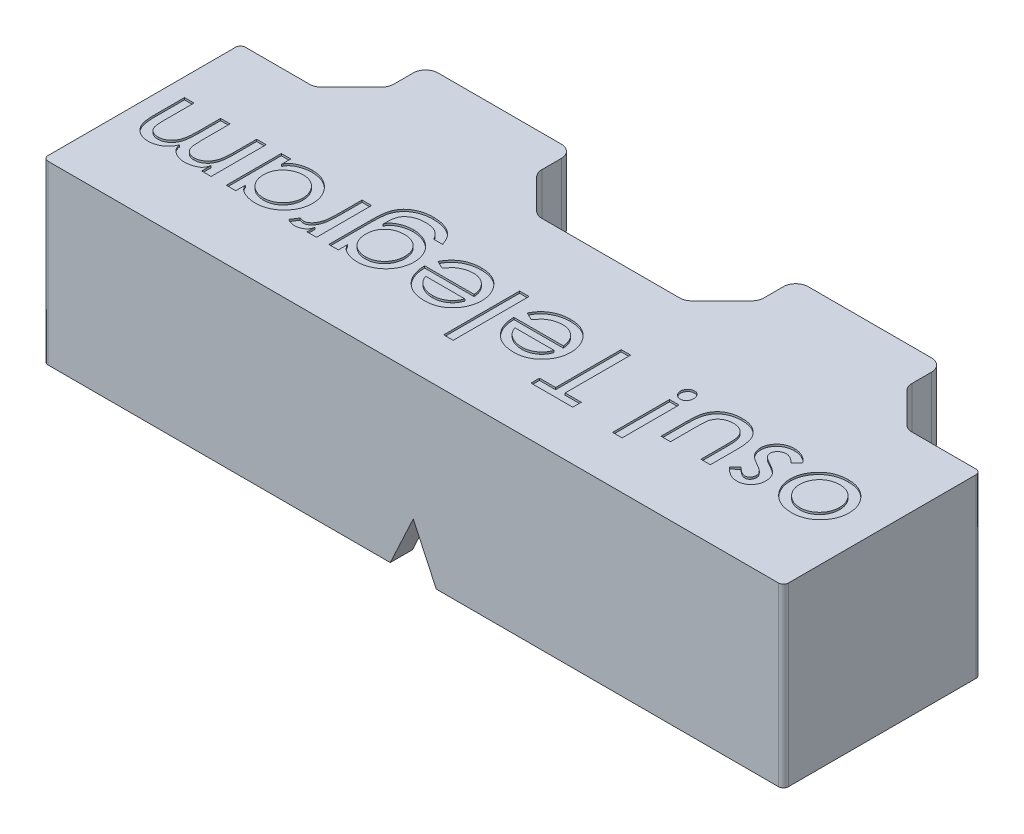
from build123d import *

# Parameters (mm, degrees)
SKETCH1_W               = 60
SKETCH1_H               = 16
BOSS_EXTRUDE1_DEPTH     = 6.5
CUT_EXTRUDE1_DEPTH      = 11
CUT_EXTRUDE1_DEPTH_BACK = 11
CUT_EXTRUDE5_DEPTH      = 11
CUT_EXTRUDE5_DEPTH_BACK = 11
BOSS_EXTRUDE2_DEPTH     = 7.8
SKETCH5_W               = 12
SKETCH5_H               = 1
CUT_EXTRUDE6_DEPTH      = 8
SKETCH6_W               = 12
SKETCH6_H               = 5.5
BOSS_EXTRUDE3_DEPTH     = 6
FILLET1_R               = 1
CHAMFER1_SIZE           = 3
FILLET2_R               = 1
FILLET3_R               = 0.4
SKETCH7_W               = 0.769230769
SKETCH7_H               = 4.615384616
SKETCH7_W_2             = 0.76923077
SKETCH7_H_2             = 6.153846154
CUT_EXTRUDE7_DEPTH      = 0.16
CUT_EXTRUDE8_REACH      = 67.487


with BuildPart() as part:
    # Sketch1 → Boss-Extrude1 (new body)
    with BuildSketch(Plane(origin=(0, 0, 0), x_dir=(1, 0, 0), z_dir=(0, 1, 0))):
        with Locations((30, -8)):
            Rectangle(SKETCH1_W, SKETCH1_H)
    extrude(amount=-BOSS_EXTRUDE1_DEPTH)

    # Sketch2 → Cut-Extrude1 (cut, two sides: drawn at the far end of the back side and taken through both)
    with BuildSketch(Plane.ZY.offset(-15).offset(-CUT_EXTRUDE1_DEPTH_BACK)):
        with BuildLine():
            Line((12.5, -6.5), (3.5, -6.5))
            ThreePointArc((3.5, -6.5), (8, -2), (12.5, -6.5))
        make_face()
    extrude(amount=CUT_EXTRUDE1_DEPTH + CUT_EXTRUDE1_DEPTH_BACK, mode=Mode.SUBTRACT)

    # Sketch3 → Cut-Extrude5 (cut, two sides: drawn at the far end of the back side and taken through both)
    with BuildSketch(Plane(origin=(45, 0, 0), x_dir=(0, 0, -1), z_dir=(1, 0, 0)).offset(-CUT_EXTRUDE5_DEPTH_BACK)):
        with BuildLine():
            Line((-12.5, -6.5), (-3.5, -6.5))
            ThreePointArc((-3.5, -6.5), (-8, -2), (-12.5, -6.5))
        make_face()
    extrude(amount=CUT_EXTRUDE5_DEPTH + CUT_EXTRUDE5_DEPTH_BACK, mode=Mode.SUBTRACT)

    # Sketch4 → Boss-Extrude2 (add)
    with BuildSketch(Plane.XZ.offset(6.5)):
        Polygon((1.8, 0), (1.8, 14.2), (58.2, 14.2), (58.2, 0), (60, 0), (60, 16), (0, 16), (0, 0), align=None)
    extrude(amount=BOSS_EXTRUDE2_DEPTH)

    # Sketch5 → Cut-Extrude6 (cut)
    with BuildSketch(Plane(origin=(0, 0, 0), x_dir=(-1, 0, 0), z_dir=(0, 0, -1))):
        with Locations((-45, -6)):
            Rectangle(SKETCH5_W, SKETCH5_H)
        with Locations((-15, -6)):
            Rectangle(SKETCH5_W, SKETCH5_H)
    extrude(amount=-CUT_EXTRUDE6_DEPTH, mode=Mode.SUBTRACT)

    # Sketch6 → Boss-Extrude3 (add)
    with BuildSketch(Plane(origin=(0, 0, 0), x_dir=(-1, 0, 0), z_dir=(0, 0, -1))):
        with Locations((-45, -2.75)):
            Rectangle(SKETCH6_W, SKETCH6_H)
        with Locations((-15, -2.75)):
            Rectangle(SKETCH6_W, SKETCH6_H)
    extrude(amount=BOSS_EXTRUDE3_DEPTH)

    # Fillet1
    fillet1_edges = [part.edges().sort_by_distance(p)[0] for p in [
        (9, -5.996844891, 3.528217924),
        (21, -5.996844891, 3.528217924),
        (51, -5.996844891, 3.528217924),
        (39, -5.996844891, 3.528217924),
        (26, -2, 8),
        (4, -2, 8),
        (34, -2, 8),
        (56, -2, 8),
    ]]
    fillet(fillet1_edges, radius=FILLET1_R)

    # Chamfer1
    chamfer1_edges = [part.edges().sort_by_distance(p)[0] for p in [
        (9, -2.75, 0),
        (21, -2.75, 0),
        (51, -2.75, 0),
        (39, -2.75, 0),
    ]]
    chamfer(chamfer1_edges, length=CHAMFER1_SIZE)

    # Fillet2
    fillet2_edges = [part.edges().sort_by_distance(p)[0] for p in [
        (51, -2.75, -6),
        (9, -2.75, -6),
        (21, -2.75, -6),
        (39, -2.75, -6),
        (9, -2.75, -3),
        (6, -2.75, 0),
        (21, -2.75, -3),
        (24, -2.75, 0),
        (36, -2.75, 0),
        (39, -2.75, -3),
        (51, -2.75, -3),
        (54, -2.75, 0),
    ]]
    fillet(fillet2_edges, radius=FILLET2_R)

    # Fillet3
    fillet3_edges = [part.edges().sort_by_distance(p)[0] for p in [
        (0, -7.15, 16),
        (60, -7.15, 16),
        (60, -7.15, 0),
        (58.2, -10.4, 0),
        (58.2, -10.4, 14.2),
        (1.8, -10.4, 14.2),
        (1.8, -10.4, 0),
        (0, -7.15, 0),
        (9, -6, 0),
        (21, -6, 0),
        (39, -6, 0),
        (51, -6, 0),
    ]]
    fillet(fillet3_edges, radius=FILLET3_R)

    # Sketch7 → Cut-Extrude7 (cut)
    # profile 1 of 13: a face of its own
    with BuildSketch(Plane(origin=(0, 0, 0), x_dir=(1, 0, 0), z_dir=(0, 1, 0))):
        with BuildLine():
            add(Edge.make_bspline(
                [(55.189903846, -10.538461538), (55.100861997, -10.536028302), (54.926534862, -10.531264483), (54.671481239, -10.497606584), (54.429524935, -10.439600327), (54.199820531, -10.358847572), (53.982435007, -10.255183188), (53.777849368, -10.128151969), (53.586727583, -9.977203667), (53.471624931, -9.86140149), (53.413461538, -9.802884615)],
                knots=[0, 0, 0, 0, 1.078802918, 2.112092493, 3.110573245, 4.088605452, 5.057036471, 6.022908947, 7.000941154, 8, 8, 8, 8], degree=3))
            add(Edge.make_bspline(
                [(53.413461538, -9.802884615), (53.361752234, -9.744976058), (53.260242879, -9.631297089), (53.131019822, -9.446172988), (53.017503518, -9.258159924), (52.92780201, -9.061730969), (52.855074823, -8.860329728), (52.807708943, -8.651477006), (52.773749533, -8.43740286), (52.770748834, -8.292205782), (52.769230769, -8.21875)],
                knots=[0, 0, 0, 0, 1.062297535, 2.08537206, 3.086585084, 4.066078755, 5.037873789, 6.013379158, 6.994960584, 8, 8, 8, 8], degree=3))
            add(Edge.make_bspline(
                [(52.769230769, -8.21875), (52.771345235, -8.144917688), (52.775535813, -7.998592308), (52.807982845, -7.782441852), (52.859273549, -7.5720357), (52.933147357, -7.368396888), (53.027739681, -7.171378845), (53.142436522, -6.980337283), (53.279402223, -6.796460101), (53.433878926, -6.619689767), (53.605991764, -6.456851309), (53.792537541, -6.312660761), (53.993741456, -6.192088898), (54.207427199, -6.092574007), (54.43524151, -6.017471541), (54.674863992, -5.961827857), (54.928174739, -5.928972742), (55.101265359, -5.92507363), (55.189903846, -5.923076923)],
                knots=[0, 0, 0, 0, 0.952949009, 1.888612482, 2.815772097, 3.74519454, 4.679942406, 5.633621214, 6.617530854, 7.636523821, 8.661121016, 9.671967076, 10.67443989, 11.68352405, 12.709178413, 13.765726999, 14.855844533, 16, 16, 16, 16], degree=3))
            add(Edge.make_bspline(
                [(55.189903846, -5.923076923), (55.274557916, -5.925020775), (55.4405044, -5.928831286), (55.682998308, -5.962675362), (55.914251818, -6.014290561), (56.132495999, -6.091203302), (56.340020095, -6.18703919), (56.53383316, -6.307376647), (56.716785605, -6.447325814), (56.884557638, -6.60817259), (57.037184423, -6.782077411), (57.171477605, -6.965324834), (57.285012767, -7.156058117), (57.378553352, -7.353798242), (57.449303236, -7.56003559), (57.501443334, -7.772703718), (57.531833327, -7.993517811), (57.536230497, -8.142937351), (57.538461538, -8.21875)],
                knots=[0, 0, 0, 0, 1.109057218, 2.174073239, 3.203365032, 4.209803551, 5.20120997, 6.193742316, 7.193679502, 8.215171888, 9.234813289, 10.223210965, 11.188672856, 12.140107922, 13.085086393, 14.041623643, 15.006356879, 16, 16, 16, 16], degree=3))
            add(Edge.make_bspline(
                [(57.538461538, -8.21875), (57.536645488, -8.293757855), (57.533067509, -8.441538171), (57.503737622, -8.659436506), (57.453973886, -8.868804897), (57.386888831, -9.071337741), (57.298303413, -9.265492916), (57.190606354, -9.452365985), (57.064771574, -9.632646921), (56.966681559, -9.743306744), (56.917067308, -9.799278846)],
                knots=[0, 0, 0, 0, 1.034079547, 2.037341334, 3.024980457, 3.998111168, 4.974764182, 5.962233312, 6.969290918, 8, 8, 8, 8], degree=3))
            add(Edge.make_bspline(
                [(56.917067308, -9.799278846), (56.859348975, -9.858239514), (56.745560599, -9.974477081), (56.556161224, -10.125178891), (56.35633505, -10.253672311), (56.144071692, -10.356994813), (55.921848401, -10.440011679), (55.687481753, -10.497226552), (55.442107424, -10.53123965), (55.274948605, -10.536026269), (55.189903846, -10.538461538)],
                knots=[0, 0, 0, 0, 1.021997278, 2.014808882, 2.992991082, 3.961403697, 4.935644248, 5.92819495, 6.945935601, 8, 8, 8, 8], degree=3))
        make_face()
        with BuildLine():
            add(Edge.make_bspline(
                [(55.192307692, -9.846153846), (55.243666489, -9.844785197), (55.345642123, -9.84206767), (55.495845066, -9.819833148), (55.641831036, -9.783870827), (55.782020136, -9.73168521), (55.918445162, -9.666376537), (56.048856734, -9.585555806), (56.175279536, -9.490763484), (56.294996153, -9.382430311), (56.406314667, -9.263867401), (56.502983246, -9.135467216), (56.585177731, -9.000212449), (56.653090504, -8.857870277), (56.704942196, -8.707366001), (56.741628953, -8.549872118), (56.765692236, -8.384951908), (56.768035093, -8.272522523), (56.769230769, -8.215144231)],
                knots=[0, 0, 0, 0, 0.977091595, 1.940067522, 2.883247161, 3.833734333, 4.781832803, 5.75743561, 6.748705817, 7.785334412, 8.826635868, 9.839261104, 10.838360171, 11.834311728, 12.83506799, 13.861550998, 14.908643384, 16, 16, 16, 16], degree=3))
            add(Edge.make_bspline(
                [(56.769230769, -8.215144231), (56.766331679, -8.140450266), (56.760629168, -7.993527229), (56.719100524, -7.777514494), (56.647263785, -7.572598855), (56.550038895, -7.3791687), (56.430463504, -7.202947237), (56.294414775, -7.045220341), (56.138713055, -6.913672294), (55.968869916, -6.804962041), (55.786386492, -6.721224977), (55.595829475, -6.659167893), (55.396466868, -6.622106621), (55.260971501, -6.617645393), (55.192307692, -6.615384615)],
                knots=[0, 0, 0, 0, 1.073871653, 2.112305672, 3.149076096, 4.187462164, 5.216567997, 6.204631787, 7.173270821, 8.137031243, 9.095957466, 10.052526835, 11.013095959, 12, 12, 12, 12], degree=3))
            add(Edge.make_bspline(
                [(55.192307692, -6.615384615), (55.118013435, -6.617915031), (54.971612674, -6.622901348), (54.757248152, -6.662769852), (54.552137661, -6.726226827), (54.359002294, -6.816868288), (54.179460768, -6.929441093), (54.017461837, -7.064919423), (53.877890393, -7.224778492), (53.756688762, -7.401440259), (53.659714546, -7.593052861), (53.589237207, -7.793740282), (53.547090208, -8.002257268), (53.541359729, -8.143639938), (53.538461538, -8.215144231)],
                knots=[0, 0, 0, 0, 1.043087262, 2.055458593, 3.052331559, 4.051997069, 5.043564897, 6.022205389, 7.0070413, 8.015525031, 9.024887916, 10.014585025, 10.995876263, 12, 12, 12, 12], degree=3))
            add(Edge.make_bspline(
                [(53.538461538, -8.215144231), (53.539710172, -8.270516169), (53.542173268, -8.379744733), (53.56584485, -8.54041711), (53.603798168, -8.694893769), (53.659123048, -8.842613458), (53.727075387, -8.984998428), (53.812261703, -9.12046445), (53.912674238, -9.249157662), (54.025894621, -9.370843188), (54.150085741, -9.48205218), (54.282081458, -9.579520947), (54.420015631, -9.661489822), (54.562741984, -9.730152422), (54.71226779, -9.78124063), (54.867130939, -9.818651091), (55.02770688, -9.842476857), (55.13693565, -9.844916899), (55.192307692, -9.846153846)],
                knots=[0, 0, 0, 0, 1.029247307, 2.030328165, 3.013444683, 3.982368243, 4.958826403, 5.942958945, 6.95199466, 7.9906125, 9.030192123, 10.048075473, 11.037160224, 12.010400487, 12.988335892, 13.969671835, 14.970752693, 16, 16, 16, 16], degree=3))
        make_face(mode=Mode.SUBTRACT)
    # profile 2 of 13: a face of its own
    with BuildSketch(Plane(origin=(0, 0, 0), x_dir=(1, 0, 0), z_dir=(0, 1, 0))):
        with BuildLine():
            Line((49.461538462, -9.830528846), (49.953125, -9.384615385))
            add(Edge.make_bspline(
                [(49.953125, -9.384615385), (49.989105878, -9.421176843), (50.058356014, -9.491544385), (50.165483344, -9.584609632), (50.2677278, -9.665381887), (50.367539952, -9.730439919), (50.463906936, -9.781783961), (50.556963721, -9.818303323), (50.646695664, -9.841615971), (50.705804108, -9.844675149), (50.734375, -9.846153846)],
                knots=[0, 0, 0, 0, 1.323954473, 2.548132, 3.661338868, 4.685637623, 5.620299102, 6.475132344, 7.262933916, 8, 8, 8, 8], degree=3))
            add(Edge.make_bspline(
                [(50.734375, -9.846153846), (50.759456142, -9.844615671), (50.81022633, -9.841502039), (50.883866118, -9.812725779), (50.954463292, -9.768014576), (51.022073986, -9.708943603), (51.081183488, -9.635271496), (51.123405306, -9.54818942), (51.149712861, -9.450636189), (51.152428525, -9.381988995), (51.153846154, -9.346153846)],
                knots=[0, 0, 0, 0, 0.832490187, 1.685157841, 2.595972223, 3.607628721, 4.662023247, 5.718189086, 6.808851023, 8, 8, 8, 8], degree=3))
            add(Edge.make_bspline(
                [(51.153846154, -9.346153846), (51.15253863, -9.313962666), (51.149974025, -9.250822184), (51.127695647, -9.160750539), (51.092889383, -9.076839603), (51.057555135, -9.029020922), (51.039663462, -9.004807692)],
                knots=[0, 0, 0, 0, 1.051272635, 2.061989066, 3.018678432, 4, 4, 4, 4], degree=3))
            add(Edge.make_bspline(
                [(51.039663462, -9.004807692), (51.008464339, -8.970265366), (50.940552701, -8.895076524), (50.80928157, -8.792454314), (50.647012415, -8.68643268), (50.525335029, -8.618970251), (50.460336538, -8.582932692)],
                knots=[0, 0, 0, 0, 0.773812761, 1.684370807, 2.763020755, 4, 4, 4, 4], degree=3))
            add(Edge.make_bspline(
                [(50.460336538, -8.582932692), (50.408866791, -8.554817508), (50.309936791, -8.500777313), (50.170499958, -8.417703272), (50.044064103, -8.337090641), (49.932385058, -8.256862615), (49.83246883, -8.180501886), (49.748493046, -8.104208703), (49.676008242, -8.031431681), (49.636542003, -7.979978388), (49.617788462, -7.955528846)],
                knots=[0, 0, 0, 0, 1.33007668, 2.556540363, 3.680712794, 4.729650924, 5.674864377, 6.530627546, 7.301784576, 8, 8, 8, 8], degree=3))
            add(Edge.make_bspline(
                [(49.617788462, -7.955528846), (49.581791768, -7.899662117), (49.511461922, -7.790510467), (49.440541526, -7.612233574), (49.392386256, -7.431234855), (49.387205364, -7.308000363), (49.384615385, -7.246394231)],
                knots=[0, 0, 0, 0, 1.050203962, 2.051874098, 3.026112749, 4, 4, 4, 4], degree=3))
            add(Edge.make_bspline(
                [(49.384615385, -7.246394231), (49.385615626, -7.202643183), (49.387589502, -7.116304913), (49.407912303, -6.989556658), (49.438672738, -6.866815673), (49.484350218, -6.749132737), (49.538741928, -6.633562693), (49.609957874, -6.524337894), (49.691598211, -6.418303981), (49.784914373, -6.317656391), (49.888665851, -6.225705951), (50.000811832, -6.145111481), (50.119638099, -6.075593878), (50.246124152, -6.019106329), (50.380297075, -5.975483583), (50.521888403, -5.946477945), (50.67007458, -5.925901486), (50.771560107, -5.92403091), (50.823317308, -5.923076923)],
                knots=[0, 0, 0, 0, 0.963296146, 1.900967574, 2.82169578, 3.746478217, 4.678313113, 5.630992196, 6.612800321, 7.624786464, 8.650465775, 9.6623749, 10.663248277, 11.678847707, 12.709038353, 13.765265656, 14.860294689, 16, 16, 16, 16], degree=3))
            add(Edge.make_bspline(
                [(50.823317308, -5.923076923), (50.886739181, -5.925254535), (51.013145862, -5.929594751), (51.200429492, -5.96160589), (51.382854413, -6.01505708), (51.560129154, -6.088477916), (51.729642403, -6.182361165), (51.886156566, -6.301166946), (52.030670278, -6.440436589), (52.112360506, -6.548490949), (52.153846154, -6.603365385)],
                knots=[0, 0, 0, 0, 0.979503693, 1.952257251, 2.92571941, 3.910780478, 4.911123098, 5.910086145, 6.938656042, 8, 8, 8, 8], degree=3))
            Line((52.153846154, -6.603365385), (51.700721154, -7.076923077))
            add(Edge.make_bspline(
                [(51.700721154, -7.076923077), (51.662319375, -7.040352519), (51.588244685, -6.969810145), (51.473891277, -6.876239299), (51.36334497, -6.796334824), (51.255996684, -6.730491529), (51.151332123, -6.679617583), (51.049538255, -6.6428666), (50.950543763, -6.619900248), (50.885126798, -6.616860488), (50.853365385, -6.615384615)],
                knots=[0, 0, 0, 0, 1.288506075, 2.485449601, 3.588003455, 4.601705531, 5.542438646, 6.411005369, 7.228507225, 8, 8, 8, 8], degree=3))
            add(Edge.make_bspline(
                [(50.853365385, -6.615384615), (50.806290109, -6.617769015), (50.714487162, -6.622418905), (50.581959848, -6.656699517), (50.461141973, -6.715277314), (50.355168835, -6.795850938), (50.266805582, -6.890420826), (50.200900182, -6.995278211), (50.161693007, -7.10950892), (50.156484077, -7.188408701), (50.153846154, -7.228365385)],
                knots=[0, 0, 0, 0, 1.096025125, 2.137392371, 3.164312155, 4.204088696, 5.221248568, 6.164137697, 7.070276657, 8, 8, 8, 8], degree=3))
            add(Edge.make_bspline(
                [(50.153846154, -7.228365385), (50.155477695, -7.2609788), (50.158686307, -7.325116788), (50.18387952, -7.418388293), (50.2249096, -7.506738668), (50.264580551, -7.558752873), (50.284855769, -7.585336538)],
                knots=[0, 0, 0, 0, 1.00762038, 1.981599971, 2.968426558, 4, 4, 4, 4], degree=3))
            add(Edge.make_bspline(
                [(50.284855769, -7.585336538), (50.297819593, -7.599618506), (50.326248323, -7.630937831), (50.378805897, -7.676028923), (50.442171999, -7.724973177), (50.516938556, -7.776502987), (50.602979438, -7.830608822), (50.700098822, -7.888415612), (50.809669076, -7.947917364), (50.886574205, -7.988467297), (50.926682692, -8.009615385)],
                knots=[0, 0, 0, 0, 0.598336818, 1.312109489, 2.145574209, 3.084074998, 4.129639589, 5.300765043, 6.592262554, 8, 8, 8, 8], degree=3))
            add(Edge.make_bspline(
                [(50.926682692, -8.009615385), (50.972487237, -8.035021124), (51.061193125, -8.084222326), (51.188169213, -8.159698338), (51.303195625, -8.23644557), (51.407115168, -8.312999169), (51.498373039, -8.390838549), (51.581091514, -8.465741416), (51.65136183, -8.542489801), (51.690375032, -8.596584567), (51.709134615, -8.622596154)],
                knots=[0, 0, 0, 0, 1.253776687, 2.428085991, 3.534570664, 4.562637991, 5.515491904, 6.404480427, 7.232790918, 8, 8, 8, 8], degree=3))
            add(Edge.make_bspline(
                [(51.709134615, -8.622596154), (51.74221088, -8.674925877), (51.808232362, -8.779377997), (51.874760524, -8.953813256), (51.915893183, -9.138689813), (51.920653133, -9.265802465), (51.923076923, -9.330528846)],
                knots=[0, 0, 0, 0, 0.987296514, 1.970681444, 2.966661107, 4, 4, 4, 4], degree=3))
            add(Edge.make_bspline(
                [(51.923076923, -9.330528846), (51.922404201, -9.37266179), (51.921078671, -9.455680452), (51.903083223, -9.577449785), (51.876944364, -9.694076365), (51.841457423, -9.805846189), (51.792222485, -9.910638271), (51.734548998, -10.011213727), (51.665850705, -10.106431655), (51.58682239, -10.194525384), (51.500389895, -10.27506402), (51.408265062, -10.346211732), (51.309826073, -10.405801041), (51.205565547, -10.45368108), (51.096425074, -10.492900721), (50.981245722, -10.518274302), (50.861562639, -10.536575167), (50.779721756, -10.537824398), (50.737980769, -10.538461538)],
                knots=[0, 0, 0, 0, 1.067853054, 2.104095342, 3.114909448, 4.098327083, 5.071451289, 6.045848247, 7.035860103, 8.043553062, 9.043064764, 10.028894925, 10.990971763, 11.954871835, 12.935186452, 13.926188867, 14.942302166, 16, 16, 16, 16], degree=3))
            add(Edge.make_bspline(
                [(50.737980769, -10.538461538), (50.684114202, -10.536457692), (50.575341364, -10.532411323), (50.413109103, -10.49641808), (50.251553124, -10.441362255), (50.091059706, -10.362561545), (49.931398542, -10.262419363), (49.772114469, -10.139630159), (49.613253382, -9.995362687), (49.513185265, -9.886641594), (49.461538462, -9.830528846)],
                knots=[0, 0, 0, 0, 0.858694729, 1.733963508, 2.639804497, 3.577750372, 4.580124652, 5.642817573, 6.783419306, 8, 8, 8, 8], degree=3))
        make_face()
    # profile 3 of 13: a face of its own
    with BuildSketch(Plane(origin=(0, 0, 0), x_dir=(1, 0, 0), z_dir=(0, 1, 0))):
        with BuildLine():
            Line((48.538461538, -10.461538462), (47.769230769, -10.461538462))
            Line((47.769230769, -10.461538462), (47.769230769, -8.390625))
            add(Edge.make_bspline(
                [(47.769230769, -8.390625), (47.769005001, -8.332130436), (47.768571973, -8.219936887), (47.765178673, -8.058839873), (47.758702965, -7.913036853), (47.752685012, -7.782249801), (47.740952646, -7.66696798), (47.730245654, -7.566065528), (47.714666177, -7.480660756), (47.701755893, -7.429432762), (47.695913462, -7.40625)],
                knots=[0, 0, 0, 0, 1.418944939, 2.721560048, 3.90822129, 4.959445687, 5.896519748, 6.718644391, 7.420134194, 8, 8, 8, 8], degree=3))
            add(Edge.make_bspline(
                [(47.695913462, -7.40625), (47.673926847, -7.344046436), (47.631428047, -7.223810696), (47.535225275, -7.062115747), (47.417700821, -6.924125745), (47.277576522, -6.811738657), (47.120556703, -6.72370002), (46.9484091, -6.661201138), (46.763055759, -6.621147603), (46.634427375, -6.617337279), (46.568509615, -6.615384615)],
                knots=[0, 0, 0, 0, 1.065025125, 2.058629379, 3.023717101, 3.982167637, 4.948364369, 5.922267245, 6.935231215, 8, 8, 8, 8], degree=3))
            add(Edge.make_bspline(
                [(46.568509615, -6.615384615), (46.496611106, -6.617824742), (46.357723198, -6.622538386), (46.157924313, -6.661573179), (45.975065253, -6.726442998), (45.811711648, -6.818141835), (45.669185937, -6.930053217), (45.549651082, -7.059436875), (45.45200473, -7.204416895), (45.409552263, -7.312352226), (45.388221154, -7.366586538)],
                knots=[0, 0, 0, 0, 1.152352769, 2.226024783, 3.250419965, 4.251495177, 5.216898005, 6.14450237, 7.06766729, 8, 8, 8, 8], degree=3))
            add(Edge.make_bspline(
                [(45.388221154, -7.366586538), (45.381352008, -7.389313728), (45.366222104, -7.439372381), (45.352143367, -7.525416277), (45.337133479, -7.627448159), (45.327596131, -7.747534925), (45.317200146, -7.88367033), (45.311998749, -8.037629244), (45.308268403, -8.208313143), (45.307889814, -8.328121996), (45.307692308, -8.390625)],
                knots=[0, 0, 0, 0, 0.552618492, 1.217191269, 2.027717501, 2.955623167, 4.022349436, 5.208722947, 6.543820466, 8, 8, 8, 8], degree=3))
            Line((45.307692308, -8.390625), (45.307692308, -10.461538462))
            Line((45.307692308, -10.461538462), (44.538461538, -10.461538462))
            Line((44.538461538, -10.461538462), (44.538461538, -8.286057692))
            add(Edge.make_bspline(
                [(44.538461538, -8.286057692), (44.539211824, -8.214332219), (44.540662801, -8.075622355), (44.550148715, -7.873936872), (44.566432363, -7.685791206), (44.590799683, -7.510616489), (44.620228859, -7.348832388), (44.656236346, -7.1997944), (44.698639493, -7.06402883), (44.750320758, -6.940630532), (44.808130143, -6.826874442), (44.873875688, -6.720410626), (44.946113524, -6.618869133), (45.026176872, -6.522903434), (45.115024539, -6.43378226), (45.209857446, -6.348962678), (45.313577247, -6.271217758), (45.424133206, -6.198915566), (45.5422897, -6.13340812), (45.668472139, -6.077703079), (45.801411559, -6.028523422), (45.942220315, -5.991480508), (46.089536946, -5.959110767), (46.244273641, -5.938082128), (46.406464866, -5.926290778), (46.516807232, -5.924165401), (46.573317308, -5.923076923)],
                knots=[0, 0, 0, 0, 1.441186567, 2.787110145, 4.056005154, 5.234334256, 6.339587673, 7.358787645, 8.313507725, 9.194074998, 10.043742062, 10.874902362, 11.705906707, 12.545947135, 13.382741168, 14.232446367, 15.100262939, 15.984465672, 16.88522414, 17.811311067, 18.753561775, 19.730027056, 20.734205709, 21.782741165, 22.864466402, 24, 24, 24, 24], degree=3))
            add(Edge.make_bspline(
                [(46.573317308, -5.923076923), (46.626637053, -5.923509817), (46.731048768, -5.924357519), (46.883850547, -5.938599096), (47.030405089, -5.958617917), (47.170294358, -5.986960734), (47.303897036, -6.024820662), (47.431048429, -6.070019255), (47.551727722, -6.124122871), (47.665037619, -6.187175162), (47.771771653, -6.256778361), (47.872362499, -6.332466927), (47.964701013, -6.41618699), (48.051687142, -6.50441947), (48.130068413, -6.600721432), (48.202489777, -6.702183682), (48.265716401, -6.811502989), (48.324993105, -6.926677702), (48.375443844, -7.053563587), (48.419950832, -7.19323344), (48.456705799, -7.347169695), (48.486395997, -7.515404905), (48.51032807, -7.697450254), (48.526930377, -7.894368804), (48.536198574, -8.105278117), (48.537692353, -8.25079219), (48.538461538, -8.325721154)],
                knots=[0, 0, 0, 0, 1.07597169, 2.106987754, 3.095241919, 4.061236383, 4.985566203, 5.896314517, 6.783228071, 7.652071766, 8.511262394, 9.354041321, 10.190274899, 11.025334265, 11.852760172, 12.694257424, 13.539013297, 14.39987728, 15.307027207, 16.291800133, 17.356987241, 18.49925168, 19.739217286, 21.062407783, 22.487357717, 24, 24, 24, 24], degree=3))
            Line((48.538461538, -8.325721154), (48.538461538, -10.461538462))
        make_face()
    # profile 4 of 13: a face of its own
    with BuildSketch(Plane(origin=(0, 0, 0), x_dir=(1, 0, 0), z_dir=(0, 1, 0))):
        with Locations((42.692307693, -9.846153846)):
            Rectangle(SKETCH7_W, SKETCH7_H)
    # profile 5 of 13: a face of its own
    with BuildSketch(Plane(origin=(0, 0, 0), x_dir=(1, 0, 0), z_dir=(0, 1, 0))):
        with BuildLine():
            add(Edge.make_bspline(
                [(42.730769231, -7.076923077), (42.688412515, -7.075255413), (42.606517879, -7.072031065), (42.491386763, -7.035493698), (42.389528385, -6.97834945), (42.306510677, -6.897871377), (42.240177097, -6.805849485), (42.189661746, -6.708175834), (42.159412183, -6.605135261), (42.155701537, -6.535045852), (42.153846154, -6.5)],
                knots=[0, 0, 0, 0, 1.116361404, 2.158430099, 3.159638871, 4.178787798, 5.187366709, 6.149072616, 7.074505995, 8, 8, 8, 8], degree=3))
            add(Edge.make_bspline(
                [(42.153846154, -6.5), (42.155662727, -6.46533328), (42.159296482, -6.395988225), (42.190213929, -6.294252266), (42.238630268, -6.196181155), (42.305751347, -6.104478058), (42.388233056, -6.023094254), (42.489639277, -5.96390271), (42.606038079, -5.929805895), (42.688070745, -5.925380413), (42.730769231, -5.923076923)],
                knots=[0, 0, 0, 0, 0.915453231, 1.831213197, 2.788712435, 3.797850649, 4.824864776, 5.831941418, 6.871512724, 8, 8, 8, 8], degree=3))
            add(Edge.make_bspline(
                [(42.730769231, -5.923076923), (42.765114614, -5.925027058), (42.832626352, -5.928860381), (42.928329102, -5.963215554), (43.0155876, -6.017492132), (43.088790584, -6.094101481), (43.153290638, -6.1811921), (43.197485447, -6.281044772), (43.226873187, -6.387738769), (43.229455195, -6.462137169), (43.230769231, -6.5)],
                knots=[0, 0, 0, 0, 0.969820045, 1.906347507, 2.844454448, 3.855351359, 4.888107007, 5.898494394, 6.930501848, 8, 8, 8, 8], degree=3))
            add(Edge.make_bspline(
                [(43.230769231, -6.5), (43.228826438, -6.538215587), (43.225035161, -6.612791655), (43.19797479, -6.720969631), (43.151988536, -6.820587972), (43.088065012, -6.908320058), (43.013777419, -6.98401063), (42.926710879, -7.037733179), (42.831239499, -7.07086338), (42.764688882, -7.07487727), (42.730769231, -7.076923077)],
                knots=[0, 0, 0, 0, 1.081653211, 2.110799551, 3.136186668, 4.168891594, 5.17174835, 6.119434107, 7.041509438, 8, 8, 8, 8], degree=3))
        make_face()
    # profile 6 of 13: a face of its own
    with BuildSketch(Plane(origin=(0, 0, 0), x_dir=(1, 0, 0), z_dir=(0, 1, 0))):
        Polygon((38.923076923, -11.307692308), (38.923076923, -12), (35.538461538, -12), (35.538461538, -11.307692308), (36.846153846, -11.307692308), (36.846153846, -6), (37.615384615, -6), (37.615384615, -11.307692308), align=None)
    # profile 7 of 13: a face of its own
    with BuildSketch(Plane(origin=(0, 0, 0), x_dir=(1, 0, 0), z_dir=(0, 1, 0))):
        with BuildLine():
            Line((31.102163462, -7.538461538), (30.461538462, -7.231971154))
            add(Edge.make_bspline(
                [(30.461538462, -7.231971154), (30.502059536, -7.15838149), (30.580970723, -7.015072169), (30.715107702, -6.817170776), (30.861898426, -6.64407028), (31.018059655, -6.492211736), (31.185499464, -6.360148778), (31.363748982, -6.24601654), (31.552881681, -6.148032189), (31.752831863, -6.065580417), (31.966016385, -6.002407892), (32.19129884, -5.954674862), (32.430497017, -5.929054242), (32.594095446, -5.925101416), (32.677884615, -5.923076923)],
                knots=[0, 0, 0, 0, 1.110439497, 2.162482102, 3.154813102, 4.106375866, 5.037954949, 5.969594278, 6.900751532, 7.851045329, 8.824749065, 9.836682175, 10.892027235, 12, 12, 12, 12], degree=3))
            add(Edge.make_bspline(
                [(32.677884615, -5.923076923), (32.766549115, -5.924903692), (32.939742824, -5.928472029), (33.191489693, -5.963543691), (33.429030206, -6.016624728), (33.651531988, -6.093472792), (33.858035313, -6.194509828), (34.051108841, -6.314611588), (34.227432793, -6.459313417), (34.387366041, -6.623639436), (34.52953337, -6.801625247), (34.656209248, -6.986170668), (34.761771766, -7.17764585), (34.849174268, -7.374538989), (34.916818092, -7.577401828), (34.964638154, -7.785882255), (34.994693989, -8.000326047), (34.998216546, -8.145333457), (35, -8.21875)],
                knots=[0, 0, 0, 0, 1.164678857, 2.275037399, 3.333961988, 4.359782605, 5.36067657, 6.349740885, 7.341548717, 8.350650543, 9.35804734, 10.332197302, 11.289117019, 12.227427292, 13.159912856, 14.09490764, 15.035461054, 16, 16, 16, 16], degree=3))
            add(Edge.make_bspline(
                [(35, -8.21875), (34.998438011, -8.28734311), (34.995339843, -8.423395873), (34.96891543, -8.6243258), (34.92863283, -8.819934336), (34.870606639, -9.009421723), (34.795508848, -9.193121468), (34.703902927, -9.37128908), (34.59572636, -9.54387474), (34.512141006, -9.652103241), (34.469951923, -9.706730769)],
                knots=[0, 0, 0, 0, 1.021096707, 2.025320431, 3.012923591, 3.992437812, 4.971861174, 5.964497656, 6.972595394, 8, 8, 8, 8], degree=3))
            add(Edge.make_bspline(
                [(34.469951923, -9.706730769), (34.412899286, -9.773011127), (34.300446386, -9.903652211), (34.108804607, -10.073572722), (33.903426452, -10.218148752), (33.68295873, -10.334854861), (33.44903604, -10.427582594), (33.200322585, -10.49169461), (32.937553178, -10.531031548), (32.75775291, -10.535948642), (32.665865385, -10.538461538)],
                knots=[0, 0, 0, 0, 1.018725525, 2.007946416, 2.977291296, 3.940674949, 4.909614547, 5.904411593, 6.929042575, 8, 8, 8, 8], degree=3))
            add(Edge.make_bspline(
                [(32.665865385, -10.538461538), (32.566751801, -10.536177773), (32.373245787, -10.531719026), (32.091730688, -10.489522092), (31.826202262, -10.422869254), (31.577327199, -10.327439244), (31.344602346, -10.205065965), (31.128089788, -10.056249075), (30.927376121, -9.880115077), (30.811274448, -9.743533834), (30.752403846, -9.674278846)],
                knots=[0, 0, 0, 0, 1.092510559, 2.132980742, 3.131821249, 4.106721871, 5.065344059, 6.025034973, 6.998572742, 8, 8, 8, 8], degree=3))
            add(Edge.make_bspline(
                [(30.752403846, -9.674278846), (30.711184748, -9.620588344), (30.629010657, -9.513551356), (30.526063133, -9.338162508), (30.436526667, -9.153963352), (30.362767175, -8.958555502), (30.307303388, -8.752172258), (30.264402348, -8.536290287), (30.239664261, -8.309848777), (30.234566552, -8.155504463), (30.231971154, -8.076923077)],
                knots=[0, 0, 0, 0, 0.947891001, 1.889708495, 2.844047414, 3.816063809, 4.811874475, 5.836031954, 6.898258033, 8, 8, 8, 8], degree=3))
            Line((30.231971154, -8.076923077), (34.231971154, -8.076923077))
            add(Edge.make_bspline(
                [(34.231971154, -8.076923077), (34.229905693, -8.025931242), (34.225849598, -7.92579486), (34.200341822, -7.779536108), (34.164808974, -7.639294343), (34.115465838, -7.504838248), (34.0512732, -7.377618537), (33.9750488, -7.256284135), (33.88552044, -7.141647024), (33.783985735, -7.034797072), (33.67433687, -6.936426039), (33.557289206, -6.850453287), (33.433997652, -6.778568406), (33.306640949, -6.717576466), (33.173051003, -6.671680176), (33.034399334, -6.639950293), (32.890519052, -6.617994396), (32.792552298, -6.616263734), (32.742788462, -6.615384615)],
                knots=[0, 0, 0, 0, 1.056711558, 2.075141491, 3.070110433, 4.052735494, 5.036868214, 6.018334664, 7.018315728, 8.046315554, 9.06971009, 10.067931139, 11.050626375, 12.023873077, 12.990293885, 13.971233241, 14.969454289, 16, 16, 16, 16], degree=3))
            add(Edge.make_bspline(
                [(32.742788462, -6.615384615), (32.689458741, -6.616563339), (32.583295343, -6.618909822), (32.425585171, -6.637047166), (32.270636936, -6.66894445), (32.11999212, -6.711579595), (31.976116389, -6.76414088), (31.842612071, -6.825178329), (31.72057718, -6.89418384), (31.604621709, -6.972094685), (31.491119502, -7.072707718), (31.370240278, -7.199673823), (31.238633621, -7.358006038), (31.149728377, -7.475566099), (31.102163462, -7.538461538)],
                knots=[0, 0, 0, 0, 0.974401844, 1.939740315, 2.895985564, 3.862406145, 4.798140639, 5.692461363, 6.541526324, 7.357860058, 8.240112752, 9.306742905, 10.55908898, 12, 12, 12, 12], degree=3))
        make_face()
        with BuildLine():
            add(Edge.make_bspline(
                [(31, -8.769230769), (31.019497327, -8.818918937), (31.058383361, -8.918018455), (31.133154488, -9.058774637), (31.222235109, -9.190191543), (31.321306443, -9.315392083), (31.438183357, -9.429443265), (31.572241825, -9.531761178), (31.724720458, -9.622192457), (31.891856103, -9.701645932), (32.070473625, -9.766249672), (32.255826001, -9.811790474), (32.445418642, -9.840496077), (32.573616615, -9.844258033), (32.638221154, -9.846153846)],
                knots=[0, 0, 0, 0, 0.917235049, 1.829360114, 2.733044354, 3.644258556, 4.569785222, 5.532849381, 6.537015909, 7.612376306, 8.710572349, 9.796536986, 10.889579082, 12, 12, 12, 12], degree=3))
            add(Edge.make_bspline(
                [(32.638221154, -9.846153846), (32.687544236, -9.844909532), (32.785273797, -9.842444028), (32.929691351, -9.82550209), (33.069696557, -9.796725453), (33.205224226, -9.75552987), (33.336172882, -9.702476726), (33.463286039, -9.638321125), (33.586087651, -9.562877077), (33.663128527, -9.504271117), (33.701923077, -9.474759615)],
                knots=[0, 0, 0, 0, 1.030056501, 2.040970785, 3.032161429, 4.011555994, 4.995123754, 5.979296403, 6.982458509, 8, 8, 8, 8], degree=3))
            add(Edge.make_bspline(
                [(33.701923077, -9.474759615), (33.751183, -9.431396564), (33.851996687, -9.342651214), (33.977145928, -9.176068903), (34.089730701, -8.985083121), (34.146147992, -8.843068016), (34.175480769, -8.769230769)],
                knots=[0, 0, 0, 0, 0.913853049, 1.870260628, 2.892694598, 4, 4, 4, 4], degree=3))
            Line((34.175480769, -8.769230769), (31, -8.769230769))
        make_face(mode=Mode.SUBTRACT)
    # profile 8 of 13: a face of its own
    with BuildSketch(Plane(origin=(0, 0, 0), x_dir=(1, 0, 0), z_dir=(0, 1, 0))):
        with Locations((29, -9.076923077)):
            Rectangle(SKETCH7_W_2, SKETCH7_H_2)
    # profile 9 of 13: a face of its own
    with BuildSketch(Plane(origin=(0, 0, 0), x_dir=(1, 0, 0), z_dir=(0, 1, 0))):
        with BuildLine():
            Line((23.871394231, -7.538461538), (23.230769231, -7.231971154))
            add(Edge.make_bspline(
                [(23.230769231, -7.231971154), (23.271290305, -7.15838149), (23.350201492, -7.015072169), (23.484338471, -6.817170776), (23.631129196, -6.64407028), (23.787290424, -6.492211736), (23.954730234, -6.360148778), (24.132979752, -6.24601654), (24.322112451, -6.148032189), (24.522062633, -6.065580417), (24.735247154, -6.002407892), (24.960529609, -5.954674862), (25.199727787, -5.929054242), (25.363326215, -5.925101416), (25.447115385, -5.923076923)],
                knots=[0, 0, 0, 0, 1.110439497, 2.162482102, 3.154813102, 4.106375866, 5.037954949, 5.969594278, 6.900751532, 7.851045329, 8.824749065, 9.836682175, 10.892027235, 12, 12, 12, 12], degree=3))
            add(Edge.make_bspline(
                [(25.447115385, -5.923076923), (25.535779884, -5.924903692), (25.708973593, -5.928472029), (25.960720463, -5.963543691), (26.198260976, -6.016624728), (26.420762757, -6.093472792), (26.627266082, -6.194509828), (26.82033961, -6.314611588), (26.996663562, -6.459313417), (27.15659681, -6.623639436), (27.298764139, -6.801625247), (27.425440017, -6.986170668), (27.531002535, -7.17764585), (27.618405037, -7.374538989), (27.686048861, -7.577401828), (27.733868923, -7.785882255), (27.763924758, -8.000326047), (27.767447316, -8.145333457), (27.769230769, -8.21875)],
                knots=[0, 0, 0, 0, 1.164678857, 2.275037399, 3.333961988, 4.359782605, 5.36067657, 6.349740885, 7.341548717, 8.350650543, 9.35804734, 10.332197302, 11.289117019, 12.227427292, 13.159912856, 14.09490764, 15.035461054, 16, 16, 16, 16], degree=3))
            add(Edge.make_bspline(
                [(27.769230769, -8.21875), (27.76766878, -8.28734311), (27.764570612, -8.423395873), (27.738146199, -8.6243258), (27.697863599, -8.819934336), (27.639837408, -9.009421723), (27.564739617, -9.193121468), (27.473133696, -9.37128908), (27.364957129, -9.54387474), (27.281371775, -9.652103241), (27.239182692, -9.706730769)],
                knots=[0, 0, 0, 0, 1.021096707, 2.025320431, 3.012923591, 3.992437812, 4.971861174, 5.964497656, 6.972595394, 8, 8, 8, 8], degree=3))
            add(Edge.make_bspline(
                [(27.239182692, -9.706730769), (27.182130055, -9.773011127), (27.069677156, -9.903652211), (26.878035376, -10.073572722), (26.672657221, -10.218148752), (26.452189499, -10.334854861), (26.218266809, -10.427582594), (25.969553354, -10.49169461), (25.706783947, -10.531031548), (25.526983679, -10.535948642), (25.435096154, -10.538461538)],
                knots=[0, 0, 0, 0, 1.018725525, 2.007946416, 2.977291296, 3.940674949, 4.909614547, 5.904411593, 6.929042575, 8, 8, 8, 8], degree=3))
            add(Edge.make_bspline(
                [(25.435096154, -10.538461538), (25.335982571, -10.536177773), (25.142476556, -10.531719026), (24.860961457, -10.489522092), (24.595433031, -10.422869254), (24.346557968, -10.327439244), (24.113833115, -10.205065965), (23.897320557, -10.056249075), (23.696606891, -9.880115077), (23.580505218, -9.743533834), (23.521634615, -9.674278846)],
                knots=[0, 0, 0, 0, 1.092510559, 2.132980742, 3.131821249, 4.106721871, 5.065344059, 6.025034973, 6.998572742, 8, 8, 8, 8], degree=3))
            add(Edge.make_bspline(
                [(23.521634615, -9.674278846), (23.480415517, -9.620588344), (23.398241426, -9.513551356), (23.295293902, -9.338162508), (23.205757436, -9.153963352), (23.131997945, -8.958555502), (23.076534157, -8.752172258), (23.033633117, -8.536290287), (23.00889503, -8.309848777), (23.003797321, -8.155504463), (23.001201923, -8.076923077)],
                knots=[0, 0, 0, 0, 0.947891001, 1.889708495, 2.844047414, 3.816063809, 4.811874475, 5.836031954, 6.898258033, 8, 8, 8, 8], degree=3))
            Line((23.001201923, -8.076923077), (27.001201923, -8.076923077))
            add(Edge.make_bspline(
                [(27.001201923, -8.076923077), (26.999136463, -8.025931242), (26.995080368, -7.92579486), (26.969572591, -7.779536108), (26.934039743, -7.639294343), (26.884696607, -7.504838248), (26.820503969, -7.377618537), (26.744279569, -7.256284135), (26.654751209, -7.141647024), (26.553216505, -7.034797072), (26.443567639, -6.936426039), (26.326519975, -6.850453287), (26.203228422, -6.778568406), (26.075871719, -6.717576466), (25.942281772, -6.671680176), (25.803630103, -6.639950293), (25.659749821, -6.617994396), (25.561783068, -6.616263734), (25.512019231, -6.615384615)],
                knots=[0, 0, 0, 0, 1.056711558, 2.075141491, 3.070110433, 4.052735494, 5.036868214, 6.018334664, 7.018315728, 8.046315554, 9.06971009, 10.067931139, 11.050626375, 12.023873077, 12.990293885, 13.971233241, 14.969454289, 16, 16, 16, 16], degree=3))
            add(Edge.make_bspline(
                [(25.512019231, -6.615384615), (25.45868951, -6.616563339), (25.352526113, -6.618909822), (25.194815941, -6.637047166), (25.039867705, -6.66894445), (24.88922289, -6.711579595), (24.745347158, -6.76414088), (24.61184284, -6.825178329), (24.489807949, -6.89418384), (24.373852478, -6.972094685), (24.260350272, -7.072707718), (24.139471047, -7.199673823), (24.00786439, -7.358006038), (23.918959146, -7.475566099), (23.871394231, -7.538461538)],
                knots=[0, 0, 0, 0, 0.974401844, 1.939740315, 2.895985564, 3.862406145, 4.798140639, 5.692461363, 6.541526324, 7.357860058, 8.240112752, 9.306742905, 10.55908898, 12, 12, 12, 12], degree=3))
        make_face()
        with BuildLine():
            add(Edge.make_bspline(
                [(23.769230769, -8.769230769), (23.788728097, -8.818918937), (23.82761413, -8.918018455), (23.902385258, -9.058774637), (23.991465878, -9.190191543), (24.090537212, -9.315392083), (24.207414127, -9.429443265), (24.341472595, -9.531761178), (24.493951228, -9.622192457), (24.661086872, -9.701645932), (24.839704394, -9.766249672), (25.02505677, -9.811790474), (25.214649412, -9.840496077), (25.342847385, -9.844258033), (25.407451923, -9.846153846)],
                knots=[0, 0, 0, 0, 0.917235049, 1.829360114, 2.733044354, 3.644258556, 4.569785222, 5.532849381, 6.537015909, 7.612376306, 8.710572349, 9.796536986, 10.889579082, 12, 12, 12, 12], degree=3))
            add(Edge.make_bspline(
                [(25.407451923, -9.846153846), (25.456775005, -9.844909532), (25.554504567, -9.842444028), (25.69892212, -9.82550209), (25.838927326, -9.796725453), (25.974454995, -9.75552987), (26.105403651, -9.702476726), (26.232516809, -9.638321125), (26.355318421, -9.562877077), (26.432359296, -9.504271117), (26.471153846, -9.474759615)],
                knots=[0, 0, 0, 0, 1.030056501, 2.040970785, 3.032161429, 4.011555994, 4.995123754, 5.979296403, 6.982458509, 8, 8, 8, 8], degree=3))
            add(Edge.make_bspline(
                [(26.471153846, -9.474759615), (26.520413769, -9.431396564), (26.621227456, -9.342651214), (26.746376698, -9.176068903), (26.85896147, -8.985083121), (26.915378761, -8.843068016), (26.944711538, -8.769230769)],
                knots=[0, 0, 0, 0, 0.913853049, 1.870260628, 2.892694598, 4, 4, 4, 4], degree=3))
            Line((26.944711538, -8.769230769), (23.769230769, -8.769230769))
        make_face(mode=Mode.SUBTRACT)
    # profile 10 of 13: a face of its own
    with BuildSketch(Plane(origin=(0, 0, 0), x_dir=(1, 0, 0), z_dir=(0, 1, 0))):
        with BuildLine():
            Line((18.384615385, -10.461538462), (17.615384615, -10.461538462))
            Line((17.615384615, -10.461538462), (17.615384615, -6.948317308))
            add(Edge.make_bspline(
                [(17.615384615, -6.948317308), (17.615692285, -6.875390087), (17.616287564, -6.734290426), (17.625204588, -6.529503365), (17.637897127, -6.339076032), (17.656033947, -6.162705399), (17.678142266, -6.000106426), (17.707057346, -5.851776878), (17.73970862, -5.716851005), (17.768606176, -5.633625846), (17.782451923, -5.59375)],
                knots=[0, 0, 0, 0, 1.276467578, 2.469710763, 3.587464513, 4.616771949, 5.572875972, 6.45864349, 7.261486614, 8, 8, 8, 8], degree=3))
            add(Edge.make_bspline(
                [(17.782451923, -5.59375), (17.801127033, -5.54485378), (17.838165072, -5.447878708), (17.910149813, -5.310777201), (17.992209471, -5.181347431), (18.085252741, -5.05964303), (18.188668316, -4.944712567), (18.304633684, -4.839064246), (18.431754113, -4.741103207), (18.569862446, -4.651582423), (18.716447139, -4.56992357), (18.871988343, -4.500240573), (19.033846879, -4.439507955), (19.20427528, -4.392418746), (19.380982742, -4.352924086), (19.565561272, -4.327841065), (19.756846069, -4.309618096), (19.88697279, -4.308341359), (19.953125, -4.307692308)],
                knots=[0, 0, 0, 0, 0.931527751, 1.847483701, 2.752140787, 3.658400555, 4.572798661, 5.502082621, 6.448361292, 7.428056975, 8.430944084, 9.433704256, 10.460969954, 11.506803974, 12.580315171, 13.683303351, 14.822266468, 16, 16, 16, 16], degree=3))
            add(Edge.make_bspline(
                [(19.953125, -4.307692308), (20.044935068, -4.309966408), (20.224650082, -4.31441788), (20.486902786, -4.343368792), (20.733860583, -4.397554602), (20.96561257, -4.468406223), (21.1789332, -4.559116147), (21.375075313, -4.661960501), (21.549192514, -4.782471872), (21.680140144, -4.895758501), (21.775820036, -4.997476648), (21.845171403, -5.08524606), (21.912422592, -5.185043872), (21.97982628, -5.294906332), (22.043965977, -5.417302969), (22.109683508, -5.549250459), (22.171522119, -5.693716652), (22.210636388, -5.794353953), (22.230769231, -5.846153846)],
                knots=[0, 0, 0, 0, 1.482732562, 2.902397424, 4.252591659, 5.560215747, 6.809896272, 7.990828954, 9.130417545, 10.22169035, 10.780122398, 11.38334421, 12.025781372, 12.722602311, 13.463587379, 14.256397759, 15.102535451, 16, 16, 16, 16], degree=3))
            Line((22.230769231, -5.846153846), (21.506009615, -5.846153846))
            add(Edge.make_bspline(
                [(21.506009615, -5.846153846), (21.483153498, -5.807856417), (21.438426442, -5.732912311), (21.366503854, -5.627123631), (21.29149603, -5.530707837), (21.215489188, -5.442535196), (21.134761973, -5.365419843), (21.053763968, -5.295231204), (20.969311443, -5.234806636), (20.852007565, -5.166608585), (20.691951415, -5.099060985), (20.482300353, -5.039393411), (20.24979628, -5.007024672), (20.08783362, -5.002403314), (20.003605769, -5)],
                knots=[0, 0, 0, 0, 0.878885226, 1.719887454, 2.519075212, 3.285650327, 4.011578718, 4.717299758, 5.39655015, 6.05472903, 7.388075791, 8.807842177, 10.339934698, 12, 12, 12, 12], degree=3))
            add(Edge.make_bspline(
                [(20.003605769, -5), (19.91490824, -5.001966408), (19.744273468, -5.00574935), (19.499591997, -5.044040842), (19.27632279, -5.103755208), (19.077773317, -5.190933954), (18.904529272, -5.295607205), (18.755353903, -5.412378138), (18.633671159, -5.543096927), (18.55309543, -5.664719122), (18.503492431, -5.77277102), (18.470955992, -5.865633604), (18.445675126, -5.970971144), (18.421937531, -6.087838024), (18.406530875, -6.21813071), (18.392641651, -6.360316722), (18.385979205, -6.515162027), (18.385082162, -6.622191633), (18.384615385, -6.677884615)],
                knots=[0, 0, 0, 0, 1.574344554, 3.028696812, 4.38749147, 5.668630263, 6.865908108, 7.975092991, 9.022541517, 10.025254038, 10.55061962, 11.131297472, 11.769917032, 12.47333045, 13.248337604, 14.098805415, 15.010711142, 16, 16, 16, 16], degree=3))
            Line((18.384615385, -6.677884615), (18.384615385, -6.824519231))
            add(Edge.make_bspline(
                [(18.384615385, -6.824519231), (18.395089591, -6.7945671), (18.41604553, -6.734641315), (18.461494017, -6.649078384), (18.520033291, -6.568897387), (18.588634887, -6.491304461), (18.669921119, -6.419012999), (18.763219247, -6.352164094), (18.867361202, -6.287747464), (19.02226254, -6.208854745), (19.228407214, -6.125414838), (19.486682205, -6.052741147), (19.753655702, -6.008103802), (19.934925193, -6.002718743), (20.026442308, -6)],
                knots=[0, 0, 0, 0, 0.586571573, 1.173564651, 1.784597632, 2.419972079, 3.08675008, 3.792608744, 4.54153723, 5.350580021, 7.006753688, 8.647322543, 10.307341383, 12, 12, 12, 12], degree=3))
            add(Edge.make_bspline(
                [(20.026442308, -6), (20.077363635, -6.000879344), (20.178609843, -6.002627732), (20.328632957, -6.017999835), (20.476656559, -6.040003955), (20.621615168, -6.074636369), (20.765475097, -6.115839211), (20.905814667, -6.169688493), (21.044607621, -6.230708562), (21.179878032, -6.301457593), (21.310073298, -6.380525875), (21.434032752, -6.465556333), (21.550175396, -6.557414197), (21.658602681, -6.656215184), (21.759469969, -6.761792029), (21.85254209, -6.874331397), (21.937828387, -6.993110435), (22.014633827, -7.118195352), (22.082958685, -7.248024666), (22.143255163, -7.381111141), (22.193738852, -7.517808396), (22.236004404, -7.656964969), (22.268609683, -7.799524965), (22.291391411, -7.945304435), (22.304634056, -8.094304623), (22.306668623, -8.194685871), (22.307692308, -8.245192308)],
                knots=[0, 0, 0, 0, 1.028384668, 2.044723794, 3.044033908, 4.049226212, 5.053146967, 6.064834927, 7.08300927, 8.1147326, 9.146043158, 10.158540145, 11.14952349, 12.134938723, 13.119555942, 14.096760629, 15.08277395, 16.071109725, 17.059478639, 18.044794156, 19.020489439, 20.001140241, 20.980855434, 21.972169228, 22.979704792, 24, 24, 24, 24], degree=3))
            add(Edge.make_bspline(
                [(22.307692308, -8.245192308), (22.306774617, -8.296107091), (22.304949985, -8.39734029), (22.290135212, -8.54752256), (22.26607206, -8.694863099), (22.232447906, -8.839466608), (22.188640948, -8.98129312), (22.13744499, -9.121544284), (22.07459558, -9.258247445), (22.002697397, -9.391543069), (21.921862377, -9.519331299), (21.836332234, -9.642851044), (21.740082176, -9.756953266), (21.637924936, -9.865923736), (21.527400753, -9.967358617), (21.410415757, -10.063327659), (21.285160445, -10.150803254), (21.153647439, -10.230620719), (21.018221149, -10.302961374), (20.879404608, -10.365190157), (20.739381335, -10.41987392), (20.596968575, -10.462856602), (20.453310021, -10.496920253), (20.307527269, -10.520789519), (20.159767255, -10.535697554), (20.060531474, -10.537539019), (20.010817308, -10.538461538)],
                knots=[0, 0, 0, 0, 1.017137415, 2.022361029, 3.012005311, 3.998406764, 4.985976862, 5.976300789, 6.979322727, 7.98937948, 8.999975344, 9.99941322, 10.988474578, 11.979445353, 12.982115852, 13.983539347, 15.000676762, 16.031705354, 17.05587448, 18.066184968, 19.069654013, 20.057224111, 21.035831668, 22.017577262, 23.006865354, 24, 24, 24, 24], degree=3))
            add(Edge.make_bspline(
                [(20.010817308, -10.538461538), (19.924524351, -10.536430775), (19.753857, -10.532414397), (19.502658141, -10.491948142), (19.259738162, -10.429637757), (19.065147967, -10.357685424), (18.918322712, -10.285576471), (18.816486565, -10.224639737), (18.722453929, -10.156609745), (18.637616359, -10.081231046), (18.560926108, -9.998834661), (18.493733405, -9.908945476), (18.432513835, -9.813258764), (18.400657974, -9.744008833), (18.384615385, -9.709134615)],
                knots=[0, 0, 0, 0, 1.607311731, 3.1788879, 4.729332402, 6.277257024, 7.035376178, 7.775630208, 8.486641184, 9.195491922, 9.887744858, 10.580762692, 11.285273084, 12, 12, 12, 12], degree=3))
            Line((18.384615385, -9.709134615), (18.384615385, -10.461538462))
        make_face()
        with BuildLine():
            add(Edge.make_bspline(
                [(19.962740385, -9.846153846), (20.030613038, -9.843469291), (20.164981338, -9.838154646), (20.363620359, -9.799806553), (20.555143802, -9.735474789), (20.739438776, -9.64755573), (20.912676053, -9.537060242), (21.067487262, -9.400013559), (21.206233057, -9.243019459), (21.322391543, -9.063651475), (21.419630281, -8.870000323), (21.48717855, -8.662902951), (21.531877937, -8.447025814), (21.536247531, -8.299505797), (21.538461538, -8.224759615)],
                knots=[0, 0, 0, 0, 0.970618979, 1.921545958, 2.882095861, 3.853661918, 4.836103896, 5.810876394, 6.801823801, 7.823919976, 8.859409592, 9.892453828, 10.932137937, 12, 12, 12, 12], degree=3))
            add(Edge.make_bspline(
                [(21.538461538, -8.224759615), (21.537063232, -8.16860203), (21.534326955, -8.058710021), (21.513313881, -7.898236955), (21.480340997, -7.745790119), (21.431690323, -7.602206607), (21.370521226, -7.466402054), (21.294092887, -7.339787738), (21.204670707, -7.221368766), (21.102720935, -7.112207654), (20.989764955, -7.014368082), (20.869829959, -6.926996413), (20.741333329, -6.854589812), (20.605772666, -6.795870502), (20.463343054, -6.747812219), (20.312713014, -6.716932346), (20.155699295, -6.694847868), (20.048559646, -6.693164884), (19.993990385, -6.692307692)],
                knots=[0, 0, 0, 0, 1.102809074, 2.158032702, 3.173839974, 4.161859901, 5.130379599, 6.094058992, 7.060498087, 8.040492747, 9.02219235, 9.991958267, 10.950546805, 11.91265027, 12.890715399, 13.897150595, 14.928959151, 16, 16, 16, 16], degree=3))
            add(Edge.make_bspline(
                [(19.993990385, -6.692307692), (19.934649799, -6.693847777), (19.818857206, -6.696852978), (19.649381804, -6.715777826), (19.488924846, -6.749648732), (19.337110254, -6.796367261), (19.193975904, -6.856212378), (19.061596098, -6.931993824), (18.936343822, -7.018165533), (18.822966464, -7.1197434), (18.719470093, -7.230588091), (18.630228416, -7.351932914), (18.553638757, -7.48084178), (18.492668627, -7.619641331), (18.442393636, -7.766031421), (18.409874419, -7.922337619), (18.388727106, -8.086358118), (18.386005603, -8.19864856), (18.384615385, -8.256009615)],
                knots=[0, 0, 0, 0, 1.125985307, 2.197159977, 3.230356954, 4.233012116, 5.207225025, 6.167096432, 7.122411724, 8.086398193, 9.049305035, 9.994984095, 10.938889412, 11.888258197, 12.866643977, 13.870105687, 14.91199123, 16, 16, 16, 16], degree=3))
            add(Edge.make_bspline(
                [(18.384615385, -8.256009615), (18.387236573, -8.33028065), (18.392357502, -8.475381489), (18.430166347, -8.687353776), (18.494259898, -8.886342865), (18.581935548, -9.072800296), (18.694430308, -9.242846331), (18.828653023, -9.395894874), (18.985736774, -9.528613901), (19.160435073, -9.642348707), (19.349473082, -9.73344578), (19.547874598, -9.798592509), (19.753214186, -9.838467846), (19.8924517, -9.843575463), (19.962740385, -9.846153846)],
                knots=[0, 0, 0, 0, 1.068329771, 2.087160199, 3.086179403, 4.068612395, 5.042296621, 6.010281783, 6.987559926, 7.99167201, 9.002364828, 9.997684997, 10.98920855, 12, 12, 12, 12], degree=3))
        make_face(mode=Mode.SUBTRACT)
    # profile 11 of 13: a face of its own
    with BuildSketch(Plane(origin=(0, 0, 0), x_dir=(1, 0, 0), z_dir=(0, 1, 0))):
        with BuildLine():
            Line((16.615384615, -10.461538462), (15.846153846, -10.461538462))
            Line((15.846153846, -10.461538462), (15.846153846, -9.828125))
            add(Edge.make_bspline(
                [(15.846153846, -9.828125), (15.841501569, -9.85707807), (15.832420985, -9.913590358), (15.809718108, -9.994910501), (15.777645089, -10.069815157), (15.739906661, -10.140760222), (15.690525912, -10.203743752), (15.636717362, -10.263815017), (15.573470484, -10.316925869), (15.47917413, -10.378080514), (15.354181141, -10.440900536), (15.198608653, -10.497238736), (15.03884357, -10.532550079), (14.930464285, -10.53648929), (14.876201923, -10.538461538)],
                knots=[0, 0, 0, 0, 0.801343046, 1.564107981, 2.30046608, 3.02599238, 3.753252712, 4.481913763, 5.227982498, 6.002607828, 7.550464093, 9.040187752, 10.518107911, 12, 12, 12, 12], degree=3))
            add(Edge.make_bspline(
                [(14.876201923, -10.538461538), (14.827084416, -10.535677357), (14.723798042, -10.529822662), (14.56609226, -10.486685663), (14.398510919, -10.421685826), (14.288604862, -10.361171336), (14.230769231, -10.329326923)],
                knots=[0, 0, 0, 0, 0.859051162, 1.806449163, 2.845692378, 4, 4, 4, 4], degree=3))
            Line((14.230769231, -10.329326923), (14.594951923, -9.770432692))
            add(Edge.make_bspline(
                [(14.594951923, -9.770432692), (14.636493087, -9.782183881), (14.71238105, -9.803651112), (14.816985543, -9.825520742), (14.899748826, -9.842095501), (14.948269069, -9.844949248), (14.96875, -9.846153846)],
                knots=[0, 0, 0, 0, 1.354987806, 2.475310119, 3.356411532, 4, 4, 4, 4], degree=3))
            add(Edge.make_bspline(
                [(14.96875, -9.846153846), (15.002299365, -9.843676519), (15.072912646, -9.838462346), (15.178131909, -9.798166053), (15.285042017, -9.734442121), (15.375169381, -9.665509776), (15.446722124, -9.596299486), (15.498286327, -9.532869518), (15.547973771, -9.461508354), (15.594173713, -9.381318454), (15.638188853, -9.292289798), (15.677878821, -9.194287446), (15.71737671, -9.088072767), (15.738879885, -9.013384025), (15.75, -8.974759615)],
                knots=[0, 0, 0, 0, 0.965395046, 2.031922553, 3.20644898, 4.54842526, 5.291530221, 6.070725605, 6.900397818, 7.795628136, 8.735547262, 9.760634092, 10.841938108, 12, 12, 12, 12], degree=3))
            add(Edge.make_bspline(
                [(15.75, -8.974759615), (15.758135463, -8.94281508), (15.776388592, -8.871142733), (15.793573174, -8.749471798), (15.810875166, -8.604084372), (15.823046214, -8.434398914), (15.834263829, -8.240899936), (15.84064451, -8.022867337), (15.845935659, -7.780474951), (15.84607887, -7.610580768), (15.846153846, -7.521634615)],
                knots=[0, 0, 0, 0, 0.541796663, 1.215601946, 2.018210726, 2.950106988, 4.012619945, 5.205915212, 6.537188929, 8, 8, 8, 8], degree=3))
            Line((15.846153846, -7.521634615), (15.846153846, -6))
            Line((15.846153846, -6), (16.615384615, -6))
            Line((16.615384615, -6), (16.615384615, -10.461538462))
        make_face()
    # profile 12 of 13: a face of its own
    with BuildSketch(Plane(origin=(0, 0, 0), x_dir=(1, 0, 0), z_dir=(0, 1, 0))):
        with BuildLine():
            Line((9.307692308, -10.461538462), (9.307692308, -6))
            Line((9.307692308, -6), (10.076923077, -6))
            Line((10.076923077, -6), (10.076923077, -6.743990385))
            add(Edge.make_bspline(
                [(10.076923077, -6.743990385), (10.090597155, -6.711966946), (10.118047435, -6.647680904), (10.172944134, -6.557785734), (10.23718168, -6.472656021), (10.311908793, -6.393468931), (10.396548537, -6.319965809), (10.490949851, -6.252103669), (10.596145922, -6.191339966), (10.748642096, -6.116026047), (10.95314907, -6.038258409), (11.210610983, -5.971118159), (11.480269168, -5.930301886), (11.663719008, -5.925515987), (11.757211538, -5.923076923)],
                knots=[0, 0, 0, 0, 0.633416723, 1.271564096, 1.912167571, 2.57285675, 3.250294026, 3.950870789, 4.686655475, 5.459972332, 7.046649965, 8.660587609, 10.298117272, 12, 12, 12, 12], degree=3))
            add(Edge.make_bspline(
                [(11.757211538, -5.923076923), (11.835836391, -5.925207917), (11.990911544, -5.929410966), (12.219301646, -5.961186534), (12.438570559, -6.014282348), (12.649846865, -6.087366506), (12.850534714, -6.185050712), (13.04432378, -6.300155875), (13.227739897, -6.438727115), (13.400071164, -6.59588877), (13.558043112, -6.7678449), (13.696908875, -6.950716704), (13.814341454, -7.143281616), (13.911242818, -7.344776915), (13.986076257, -7.556368572), (14.038706621, -7.777142542), (14.070673208, -8.007076907), (14.074817, -8.163358508), (14.076923077, -8.242788462)],
                knots=[0, 0, 0, 0, 1.033454062, 2.038325558, 3.024568002, 3.995744201, 4.971082196, 5.953886772, 6.954649988, 7.987459568, 9.016380295, 10.020312659, 11.001337225, 11.97667522, 12.954569881, 13.945932782, 14.956022565, 16, 16, 16, 16], degree=3))
            add(Edge.make_bspline(
                [(14.076923077, -8.242788462), (14.07492434, -8.32023618), (14.070971046, -8.473419761), (14.037153081, -8.698333786), (13.985176045, -8.9155098), (13.908103727, -9.122786841), (13.812108302, -9.32289703), (13.691754877, -9.51287126), (13.551740201, -9.695469151), (13.391951633, -9.866452951), (13.217721217, -10.023361407), (13.032043914, -10.160814691), (12.838241365, -10.277864216), (12.635661358, -10.374397389), (12.423633423, -10.446888937), (12.203689883, -10.500402808), (11.974885635, -10.532171809), (11.819409909, -10.536341941), (11.740384615, -10.538461538)],
                knots=[0, 0, 0, 0, 1.020735277, 2.01890886, 2.992724274, 3.960444477, 4.929202419, 5.914245548, 6.920204044, 7.959393469, 8.995691639, 10.007942493, 11.000957811, 11.97696333, 12.961042621, 13.950256236, 14.958155026, 16, 16, 16, 16], degree=3))
            add(Edge.make_bspline(
                [(11.740384615, -10.538461538), (11.644854935, -10.535848267), (11.457585068, -10.530725387), (11.183956961, -10.485784911), (10.923723928, -10.415170405), (10.71874198, -10.332764213), (10.566838751, -10.25227104), (10.463268243, -10.186812069), (10.371142886, -10.114170348), (10.290450472, -10.035819077), (10.219758693, -9.952456723), (10.160647991, -9.862843972), (10.11161949, -9.767443857), (10.088531257, -9.699849911), (10.076923077, -9.665865385)],
                knots=[0, 0, 0, 0, 1.716412424, 3.364737792, 4.970561149, 6.556865871, 7.323738578, 8.059010634, 8.756443103, 9.428803524, 10.078043193, 10.71729768, 11.355089713, 12, 12, 12, 12], degree=3))
            Line((10.076923077, -9.665865385), (10.076923077, -10.461538462))
            Line((10.076923077, -10.461538462), (9.307692308, -10.461538462))
        make_face()
        with BuildLine():
            add(Edge.make_bspline(
                [(11.728365385, -9.846153846), (11.796243718, -9.843978562), (11.930647623, -9.839671346), (12.128376816, -9.801075101), (12.318552269, -9.737563966), (12.501716441, -9.65180487), (12.67208847, -9.539701204), (12.828050896, -9.404646371), (12.966829679, -9.246186157), (13.085795296, -9.066255947), (13.184150868, -8.872151297), (13.255982452, -8.667063557), (13.299157678, -8.454128451), (13.304837195, -8.309489389), (13.307692308, -8.236778846)],
                knots=[0, 0, 0, 0, 0.974424821, 1.929430105, 2.881360406, 3.849423783, 4.826429057, 5.801601554, 6.804921475, 7.842555846, 8.892773064, 9.923070162, 10.955920386, 12, 12, 12, 12], degree=3))
            add(Edge.make_bspline(
                [(13.307692308, -8.236778846), (13.304854223, -8.164067046), (13.299223922, -8.019818585), (13.255868418, -7.806776622), (13.182913672, -7.601357835), (13.083076922, -7.405882616), (12.96358532, -7.224232355), (12.824016996, -7.0638653), (12.667765365, -6.926402862), (12.495796958, -6.814473209), (12.314483727, -6.724431006), (12.125265781, -6.662630623), (11.931266737, -6.621449163), (11.799489689, -6.617414868), (11.733173077, -6.615384615)],
                knots=[0, 0, 0, 0, 1.043912299, 2.070953307, 3.108421396, 4.166200609, 5.216438748, 6.223929854, 7.210846738, 8.195664065, 9.1633841, 10.109700595, 11.048709517, 12, 12, 12, 12], degree=3))
            add(Edge.make_bspline(
                [(11.733173077, -6.615384615), (11.660074846, -6.617875762), (11.515187381, -6.622813446), (11.300992164, -6.664105706), (11.093183847, -6.731834267), (10.894277834, -6.825449063), (10.708359665, -6.938815568), (10.544158375, -7.075342845), (10.402461938, -7.230115732), (10.283997133, -7.402716876), (10.191474259, -7.590749235), (10.125122669, -7.790893798), (10.084072863, -8.002334256), (10.079337898, -8.147248125), (10.076923077, -8.221153846)],
                knots=[0, 0, 0, 0, 1.022216178, 2.026127157, 3.040239874, 4.073587703, 5.095742383, 6.079156124, 7.051383753, 8.023288039, 8.998614306, 9.973698846, 10.96659134, 12, 12, 12, 12], degree=3))
            add(Edge.make_bspline(
                [(10.076923077, -8.221153846), (10.078173506, -8.277723346), (10.080640636, -8.389336425), (10.104171591, -8.552765705), (10.141691616, -8.709238793), (10.19269748, -8.858841696), (10.261408509, -9.000388964), (10.342978636, -9.135901014), (10.441194642, -9.263455413), (10.552432973, -9.382731272), (10.673684123, -9.491929376), (10.804765877, -9.585372119), (10.940793363, -9.667770445), (11.086039961, -9.731523469), (11.236387357, -9.784355518), (11.394482351, -9.820005521), (11.559059538, -9.842155979), (11.671402492, -9.844808765), (11.728365385, -9.846153846)],
                knots=[0, 0, 0, 0, 1.049346869, 2.070388406, 3.056868026, 4.032726246, 4.997187191, 5.971429445, 6.963358267, 7.978752948, 8.995127214, 9.985689569, 10.962482126, 11.940914689, 12.923800974, 13.915813396, 14.943224359, 16, 16, 16, 16], degree=3))
        make_face(mode=Mode.SUBTRACT)
    # profile 13 of 13: a face of its own
    with BuildSketch(Plane(origin=(0, 0, 0), x_dir=(1, 0, 0), z_dir=(0, 1, 0))):
        with BuildLine():
            Line((8.076923077, -10.461538462), (7.307692308, -10.461538462))
            Line((7.307692308, -10.461538462), (7.307692308, -9.712740385))
            add(Edge.make_bspline(
                [(7.307692308, -9.712740385), (7.300304499, -9.744962411), (7.2858897, -9.80783275), (7.254148001, -9.897551243), (7.215370253, -9.980514727), (7.171235349, -10.058705587), (7.117604366, -10.129090906), (7.058939699, -10.195233416), (6.991021427, -10.252699431), (6.941815517, -10.286090508), (6.917067308, -10.302884615)],
                knots=[0, 0, 0, 0, 1.08898891, 2.124791909, 3.129224238, 4.105481065, 5.077441123, 6.040388005, 7.014409297, 8, 8, 8, 8], degree=3))
            add(Edge.make_bspline(
                [(6.917067308, -10.302884615), (6.842563297, -10.339334563), (6.695801238, -10.411135655), (6.463373629, -10.483391521), (6.227886362, -10.530545107), (6.068735086, -10.535823242), (5.989182692, -10.538461538)],
                knots=[0, 0, 0, 0, 1.028433314, 2.025863958, 3.013220295, 4, 4, 4, 4], degree=3))
            add(Edge.make_bspline(
                [(5.989182692, -10.538461538), (5.930586757, -10.536969224), (5.814386504, -10.53400985), (5.642330009, -10.506419082), (5.475226346, -10.462068323), (5.31465315, -10.400857041), (5.164850238, -10.325753826), (5.028092805, -10.240882263), (4.907657779, -10.14469669), (4.80225648, -10.039280473), (4.714081125, -9.921612579), (4.647051156, -9.79131408), (4.59573417, -9.650081776), (4.579325782, -9.550071672), (4.570913462, -9.498798077)],
                knots=[0, 0, 0, 0, 1.099110107, 2.179620003, 3.261228271, 4.339354523, 5.398645577, 6.402155596, 7.354554768, 8.285062303, 9.193430759, 10.101550193, 11.026694879, 12, 12, 12, 12], degree=3))
            add(Edge.make_bspline(
                [(4.570913462, -9.498798077), (4.557029915, -9.53826409), (4.529576518, -9.616304392), (4.479374196, -9.728734425), (4.418561149, -9.833674125), (4.349789494, -9.932525674), (4.273043198, -10.025897583), (4.185585373, -10.110539588), (4.091897149, -10.191175313), (3.988581124, -10.261859831), (3.881113932, -10.326701259), (3.770226259, -10.38322895), (3.657588133, -10.431674586), (3.542291857, -10.469742374), (3.425817556, -10.501782425), (3.306365233, -10.523332696), (3.184931953, -10.535066036), (3.103388702, -10.53732754), (3.0625, -10.538461538)],
                knots=[0, 0, 0, 0, 1.024672991, 2.026193794, 3.01103273, 3.991165591, 4.973850373, 5.96628909, 6.969107479, 7.9982829, 9.028393851, 10.042340945, 11.044967205, 12.028827566, 13.014448664, 14.002022455, 14.998142625, 16, 16, 16, 16], degree=3))
            add(Edge.make_bspline(
                [(3.0625, -10.538461538), (3.020796782, -10.537921909), (2.938811075, -10.536861033), (2.818047389, -10.523920329), (2.701340036, -10.505588877), (2.588790412, -10.476940617), (2.479436791, -10.443049906), (2.3746361, -10.398868883), (2.273166965, -10.349001448), (2.146058267, -10.270061595), (1.9988199, -10.158739463), (1.84861458, -9.999531781), (1.721359364, -9.823150763), (1.640141844, -9.657625217), (1.58754072, -9.513087991), (1.554532245, -9.391078413), (1.525875354, -9.257457112), (1.501727893, -9.111914177), (1.484238922, -8.953796136), (1.471347982, -8.783820874), (1.462443036, -8.601455793), (1.461846871, -8.475972878), (1.461538462, -8.411057692)],
                knots=[0, 0, 0, 0, 0.823239106, 1.618432434, 2.396313085, 3.154342514, 3.910055829, 4.655047488, 5.398145899, 6.140443489, 7.607518581, 9.029035043, 10.447376899, 11.887576737, 12.653493961, 13.482794735, 14.381373994, 15.351773117, 16.395079532, 17.522016294, 18.718082286, 20, 20, 20, 20], degree=3))
            Line((1.461538462, -8.411057692), (1.461538462, -6))
            Line((1.461538462, -6), (2.230769231, -6))
            Line((2.230769231, -6), (2.230769231, -8.408653846))
            add(Edge.make_bspline(
                [(2.230769231, -8.408653846), (2.230865538, -8.462344356), (2.23105029, -8.565342626), (2.236127841, -8.712806613), (2.243259994, -8.846650417), (2.252253498, -8.96699888), (2.265543644, -9.074027911), (2.281054464, -9.167866426), (2.297969536, -9.248603928), (2.327122869, -9.336854975), (2.372593213, -9.43338595), (2.44382474, -9.535968073), (2.530038739, -9.627363604), (2.632322407, -9.705251074), (2.748687207, -9.768044216), (2.876593784, -9.813924215), (3.015749146, -9.840429214), (3.111665606, -9.844207976), (3.161057692, -9.846153846)],
                knots=[0, 0, 0, 0, 1.305396613, 2.504233864, 3.587118304, 4.564380062, 5.437970003, 6.208287575, 6.877124712, 7.44087031, 8.464886279, 9.459282465, 10.465348251, 11.507733684, 12.571297902, 13.668243822, 14.799264477, 16, 16, 16, 16], degree=3))
            add(Edge.make_bspline(
                [(3.161057692, -9.846153846), (3.216180947, -9.843608869), (3.326653148, -9.838508496), (3.488576046, -9.797083038), (3.645111766, -9.730736508), (3.794683314, -9.639873105), (3.932432114, -9.524151464), (4.055834678, -9.387788468), (4.156376196, -9.226923236), (4.227575771, -9.07793807), (4.27347652, -8.94163715), (4.302469752, -8.8208088), (4.329515886, -8.683833165), (4.348475493, -8.529503407), (4.366251596, -8.358491591), (4.375578488, -8.170344782), (4.383550634, -7.965212279), (4.384250674, -7.822926813), (4.384615385, -7.748798077)],
                knots=[0, 0, 0, 0, 0.966027362, 1.936009947, 2.912464654, 3.940695155, 4.993613158, 6.058869054, 7.152658225, 8.309745472, 8.947653374, 9.672152587, 10.488205641, 11.395776043, 12.398686906, 13.504000489, 14.699619182, 16, 16, 16, 16], degree=3))
            Line((4.384615385, -7.748798077), (4.384615385, -6))
            Line((4.384615385, -6), (5.153846154, -6))
            Line((5.153846154, -6), (5.153846154, -8.263221154))
            add(Edge.make_bspline(
                [(5.153846154, -8.263221154), (5.153933395, -8.32372272), (5.154100397, -8.439539117), (5.159276586, -8.605420999), (5.166135288, -8.755714459), (5.175879514, -8.890749196), (5.18686709, -9.010399117), (5.203043726, -9.114531753), (5.219684137, -9.2032682), (5.248545608, -9.299210753), (5.294957754, -9.403033086), (5.364271694, -9.51528846), (5.453087678, -9.612650097), (5.556024714, -9.696601932), (5.672888003, -9.764806496), (5.802227636, -9.810897824), (5.940909229, -9.841215265), (6.037091304, -9.844476993), (6.086538462, -9.846153846)],
                knots=[0, 0, 0, 0, 1.376212266, 2.634443326, 3.77497854, 4.798323497, 5.714247922, 6.506937996, 7.195074306, 7.765978788, 8.782033392, 9.773218142, 10.754126032, 11.764729726, 12.785514742, 13.814888829, 14.87663543, 16, 16, 16, 16], degree=3))
            add(Edge.make_bspline(
                [(6.086538462, -9.846153846), (6.139216049, -9.843371917), (6.245056687, -9.837782422), (6.402113145, -9.79943315), (6.55455878, -9.73368259), (6.703958263, -9.646843319), (6.842161534, -9.533867191), (6.967095204, -9.399527652), (7.069813407, -9.240336056), (7.142848724, -9.092791639), (7.189693037, -8.959417703), (7.222601141, -8.845279254), (7.247753004, -8.717205847), (7.271335088, -8.576685264), (7.287276682, -8.422514154), (7.299230621, -8.255367021), (7.306424611, -8.074982235), (7.307259993, -7.950326974), (7.307692308, -7.885817308)],
                knots=[0, 0, 0, 0, 0.974130982, 1.957239286, 2.97014007, 4.036387441, 5.142743384, 6.259792584, 7.414807906, 8.634383786, 9.295332471, 10.027165038, 10.829367816, 11.707699437, 12.661840571, 13.694497706, 14.806892053, 16, 16, 16, 16], degree=3))
            Line((7.307692308, -7.885817308), (7.307692308, -6))
            Line((7.307692308, -6), (8.076923077, -6))
            Line((8.076923077, -6), (8.076923077, -10.461538462))
        make_face()
    extrude(amount=-CUT_EXTRUDE7_DEPTH, mode=Mode.SUBTRACT)

    # Sketch8 → Cut-Extrude8 (cut, up to next)
    with BuildSketch(Plane.XY.offset(16), mode=Mode.PRIVATE) as cut_extrude8_sk1:
        Polygon((28.134769367, -14.3), (30, -10.3), (31.865230633, -14.3), align=None)
    cut_extrude8_tool1 = extrude(cut_extrude8_sk1.sketch, amount=-CUT_EXTRUDE8_REACH, mode=Mode.PRIVATE) & part.part
    add(cut_extrude8_tool1.solids().sort_by_distance((30, -12.966667, 16))[0], mode=Mode.SUBTRACT)


solid = part.part
